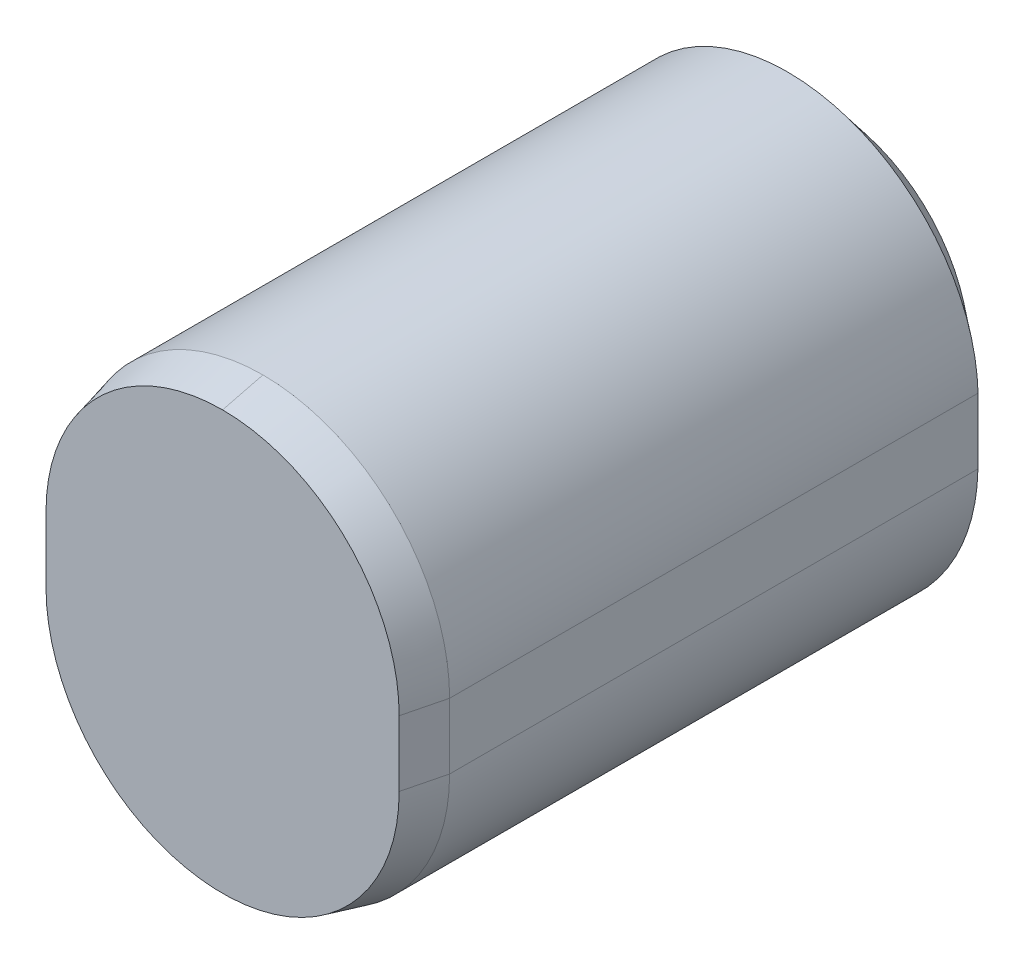
from build123d import *

# Parameters (mm, degrees)
BOSS_EXTRUDE1_DEPTH = 190.5


with BuildPart() as part:
    # Sketch1 → Boss-Extrude1 (new body)
    with BuildSketch(Plane.XY):
        with BuildLine():
            Line((-58.7375, -10.31875), (-58.7375, 10.31875))
            ThreePointArc((-58.7375, 10.31875), (0, 69.05625), (58.7375, 10.31875))
            Line((58.7375, 10.31875), (58.7375, -10.31875))
            ThreePointArc((58.7375, -10.31875), (0, -69.05625), (-58.7375, -10.31875))
        make_face()
    extrude(amount=BOSS_EXTRUDE1_DEPTH)

    # Cut-Sweep1: sweep along a path in Sketch2
    with BuildLine(Plane(origin=(0, 0, 0), x_dir=(-1, 0, 0), z_dir=(0, 0, -1))) as cut_sweep1_path:
        Line((-44.45, -8.89), (-44.45, 8.89))
        ThreePointArc((-44.45, 8.89), (0, 53.34), (44.45, 8.89))
        Line((44.45, 8.89), (44.45, -8.89))
        ThreePointArc((44.45, -8.89), (0, -53.34), (-44.45, -8.89))
    # Sketch3 → Cut-Sweep1 (sweep, cut)
    with BuildSketch(Plane(origin=(0, 0, 0), x_dir=(0, 0, -1), z_dir=(1, 0, 0))):
        Polygon((-25.127096032, 84.43478134), (11.648649354, 38.924796424), (23.103545289, 84.43478134), align=None)
    sweep(path=cut_sweep1_path.line, mode=Mode.SUBTRACT)

    # Cut-Sweep2: sweep along a path in Sketch4
    with BuildLine(Plane.XY.offset(190.5)) as cut_sweep2_path:
        Line((-55.5625, -10.31875), (-55.5625, 10.31875))
        ThreePointArc((-55.5625, 10.31875), (0, 65.88125), (55.5625, 10.31875))
        Line((55.5625, 10.31875), (55.5625, -10.31875))
        ThreePointArc((55.5625, -10.31875), (0, -65.88125), (-55.5625, -10.31875))
    # Sketch5 → Cut-Sweep2 (sweep, cut)
    with BuildSketch(Plane(origin=(0, 0, 0), x_dir=(0, 0, -1), z_dir=(1, 0, 0))):
        Polygon((-190.5, 65.88125), (-177.8, 69.05625), (-190.5, 69.05625), align=None)
    sweep(path=cut_sweep2_path.line, mode=Mode.SUBTRACT)


solid = part.part
